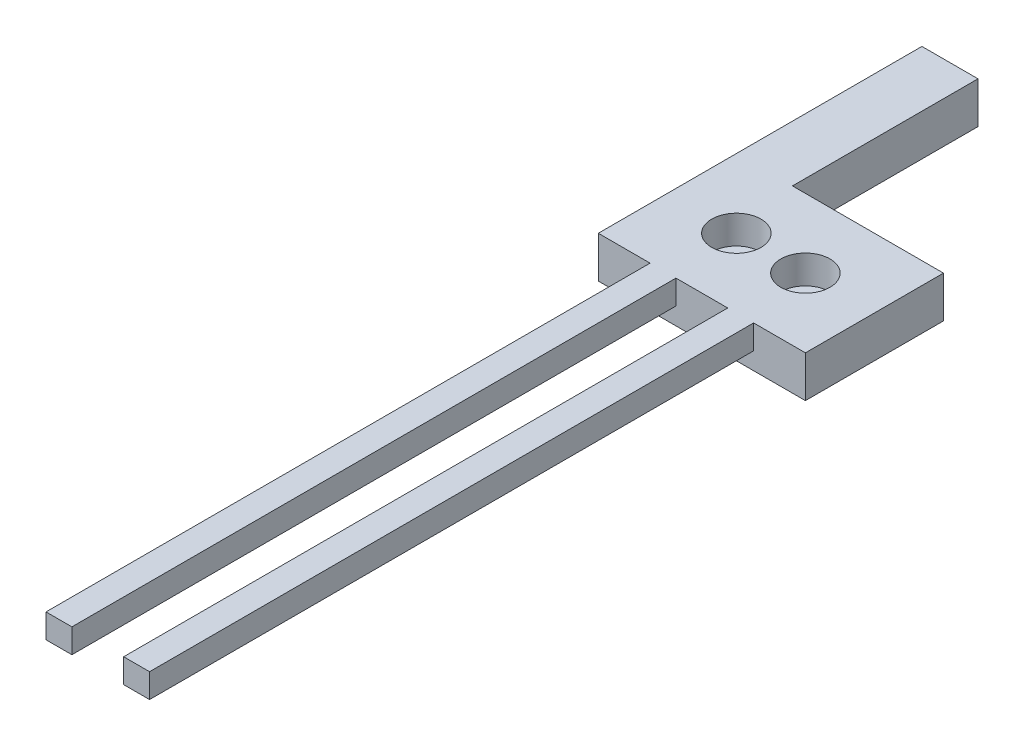
from build123d import *

# Parameters (mm, degrees)
SKETCH1_W           = 24
SKETCH1_H           = 16
SKETCH1_R           = 1.65
BOSS_EXTRUDE1_DEPTH = 4.8
SKETCH2_W           = 3
SKETCH2_H           = 2.8
BOSS_EXTRUDE2_DEPTH = 70
SKETCH3_R           = 2.85
CUT_EXTRUDE1_DEPTH  = 3.3
SKETCH4_W           = 6.5
SKETCH4_H           = 21.5
BOSS_EXTRUDE3_DEPTH = 4.8


with BuildPart() as part:
    # Sketch1 → Boss-Extrude1 (new body)
    with BuildSketch(Plane.XZ):
        with Locations((12, -8)):
            Rectangle(SKETCH1_W, SKETCH1_H)
        with Locations((8, -8)):
            Circle(SKETCH1_R, mode=Mode.SUBTRACT)
        with Locations((16, -8)):
            Circle(SKETCH1_R, mode=Mode.SUBTRACT)
    extrude(amount=BOSS_EXTRUDE1_DEPTH)

    # Sketch2 → Boss-Extrude2 (add)
    with BuildSketch(Plane.XY):
        with Locations((7.5, -1.4)):
            Rectangle(SKETCH2_W, SKETCH2_H)
        with Locations((16.5, -1.4)):
            Rectangle(SKETCH2_W, SKETCH2_H)
    extrude(amount=BOSS_EXTRUDE2_DEPTH)

    # Sketch3 → Cut-Extrude1 (cut)
    with BuildSketch(Plane(origin=(0, 0, 0), x_dir=(1, 0, 0), z_dir=(0, 1, 0))):
        with Locations((8, 8)):
            Circle(SKETCH3_R)
        with Locations((16, 8)):
            Circle(SKETCH3_R)
    extrude(amount=-CUT_EXTRUDE1_DEPTH, mode=Mode.SUBTRACT)

    # Sketch4 → Boss-Extrude3 (add)
    with BuildSketch(Plane(origin=(0, 0, 0), x_dir=(1, 0, 0), z_dir=(0, 1, 0))):
        with Locations((3.25, 26.75)):
            Rectangle(SKETCH4_W, SKETCH4_H)
    extrude(amount=-BOSS_EXTRUDE3_DEPTH)


solid = part.part
